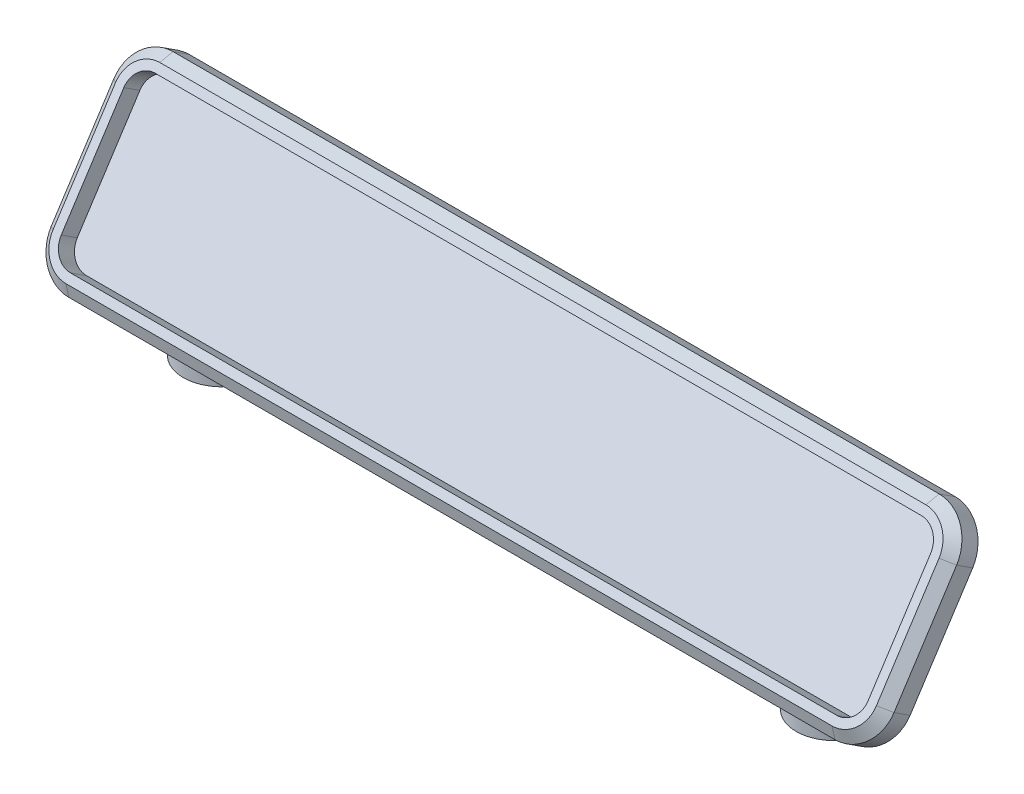
from build123d import *

# Parameters (mm, degrees)
SKETCH2_R             = 6.35
BOSS_EXTRUDE1_DEPTH   = 19.05
BOSS_EXTRUDE1_2_DEPTH = 19.05
BOSS_EXTRUDE2_DEPTH   = 6.35
BOSS_EXTRUDE3_REACH   = 75.737
CUT_EXTRUDE1_DEPTH    = 3.175
CHAMFER2_SIZE         = 1.5875
HOLE1_D               = 5.08
HOLE1_DEPTH           = 10.16
HOLE1_CBORE_D         = 6.35
HOLE1_CBORE_DEPTH     = 0.6858


with BuildPart() as part:
    # Sketch2 → Boss-Extrude1 (new body)
    with BuildSketch(Plane(origin=(0, 0, 0), x_dir=(1, 0, 0), z_dir=(0, 1, 0))):
        with Locations((-50.8, 0)):
            Circle(SKETCH2_R)
    extrude(amount=BOSS_EXTRUDE1_DEPTH)



with BuildPart() as body_2:
    # Sketch2 → Boss-Extrude1 2 (new body)
    with BuildSketch(Plane(origin=(0, 0, 0), x_dir=(1, 0, 0), z_dir=(0, 1, 0))):
        with Locations((50.8, 0)):
            Circle(SKETCH2_R)
    extrude(amount=BOSS_EXTRUDE1_2_DEPTH)


with BuildPart() as part_1:
    add(part.part)

    add(body_2.part)  # Boss-Extrude2 merges body 2
    # Sketch3 → Boss-Extrude2 (add)
    with BuildSketch(Plane(origin=(0, 5.650833475, 8.701520484), x_dir=(-1, 0, 0), z_dir=(0, 0.5446390350150281, 0.8386705679454234))):
        with BuildLine():
            ThreePointArc((-69.85, -25.501674319), (-67.990128061, -29.99180238), (-63.5, -31.851674319))
            Line((-63.5, -31.851674319), (63.5, -31.851674319))
            ThreePointArc((63.5, -31.851674319), (67.990128061, -29.99180238), (69.85, -25.501674319))
            Line((69.85, -25.501674319), (69.85, -6.451674319))
            ThreePointArc((69.85, -6.451674319), (67.990128061, -1.961546259), (63.5, -0.101674319))
            Line((63.5, -0.101674319), (-63.5, -0.101674319))
            ThreePointArc((-63.5, -0.101674319), (-67.990128061, -1.961546259), (-69.85, -6.451674319))
            Line((-69.85, -6.451674319), (-69.85, -25.501674319))
        make_face()
    extrude(amount=BOSS_EXTRUDE2_DEPTH)

    # Sketch8 → Boss-Extrude3 (add, up to next)
    with BuildSketch(Plane(origin=(0, 19.05, 0), x_dir=(1, 0, 0), z_dir=(0, 1, 0)), mode=Mode.PRIVATE) as boss_extrude3_sk1:
        with BuildLine():
            ThreePointArc((57.15, 0), (50.8, 6.35), (44.45, 0))
            Line((44.45, 0), (57.15, 0))
        make_face()
    boss_extrude3_tool1 = extrude(boss_extrude3_sk1.sketch, amount=BOSS_EXTRUDE3_REACH, mode=Mode.PRIVATE) - part_1.part
    # Sketch8 → Boss-Extrude3 (add, up to next)
    with BuildSketch(Plane(origin=(0, 19.05, 0), x_dir=(1, 0, 0), z_dir=(0, 1, 0)), mode=Mode.PRIVATE) as boss_extrude3_sk2:
        with BuildLine():
            ThreePointArc((-44.45, 0), (-50.8, 6.35), (-57.15, 0))
            Line((-57.15, 0), (-44.45, 0))
        make_face()
    boss_extrude3_tool2 = extrude(boss_extrude3_sk2.sketch, amount=BOSS_EXTRUDE3_REACH, mode=Mode.PRIVATE) - part_1.part
    add(boss_extrude3_tool1.solids().sort_by_distance((50.8, 19.05, -2.695024))[0])
    add(boss_extrude3_tool2.solids().sort_by_distance((-50.8, 19.05, -2.695024))[0])

    # Sketch9 → Cut-Extrude1 (cut)
    with BuildSketch(Plane(origin=(0, 9.109291347, 14.02707859), x_dir=(1, 0, 0), z_dir=(0, 0.5446390350150282, 0.8386705679454234))):
        with BuildLine():
            Line((63.5, 28.876674319), (-63.5, 28.876674319))
            ThreePointArc((-63.5, 28.876674319), (-65.886485387, 27.888159706), (-66.875, 25.501674319))
            Line((-66.875, 25.501674319), (-66.875, 6.451674319))
            ThreePointArc((-66.875, 6.451674319), (-65.886485387, 4.065188933), (-63.5, 3.076674319))
            Line((-63.5, 3.076674319), (63.5, 3.076674319))
            ThreePointArc((63.5, 3.076674319), (65.886485387, 4.065188933), (66.875, 6.451674319))
            Line((66.875, 6.451674319), (66.875, 25.501674319))
            ThreePointArc((66.875, 25.501674319), (65.886485387, 27.888159706), (63.5, 28.876674319))
        make_face()
    extrude(amount=-CUT_EXTRUDE1_DEPTH, mode=Mode.SUBTRACT)

    # Chamfer2
    chamfer2_edges = [part_1.edges().sort_by_distance(p)[0] for p in [
        (-69.85, 19.05, 0),
        (0, 32.363895266, -8.646144681),
        (69.85, 19.05, 0),
        (0, 5.736104734, 8.646144681),
        (0, 9.194562606, 13.971702787),
        (-69.85, 22.508457872, 5.325558106),
        (69.85, 22.508457872, 5.325558106),
        (0, 35.822353138, -3.320586574),
        (67.990128061, 30.80407541, -7.633185823),
        (-67.990128061, 30.80407541, -7.633185823),
        (67.990128061, 7.29592459, 7.633185823),
        (-67.990128061, 7.29592459, 7.633185823),
        (67.990128061, 10.754382462, 12.958743929),
        (-67.990128061, 10.754382462, 12.958743929),
        (67.990128061, 34.262533283, -2.307627716),
        (-67.990128061, 34.262533283, -2.307627716),
    ]]
    chamfer(chamfer2_edges, length=CHAMFER2_SIZE)

    # Hole1
    with Locations(Plane(origin=(-50.8, 0, 0), x_dir=(0, 0, -1), z_dir=(0, -1, 0))):
        with Locations((0, 0), (0, 101.6)):
            CounterBoreHole(HOLE1_D / 2, HOLE1_CBORE_D / 2, HOLE1_CBORE_DEPTH, depth=HOLE1_DEPTH)


solid = part_1.part
